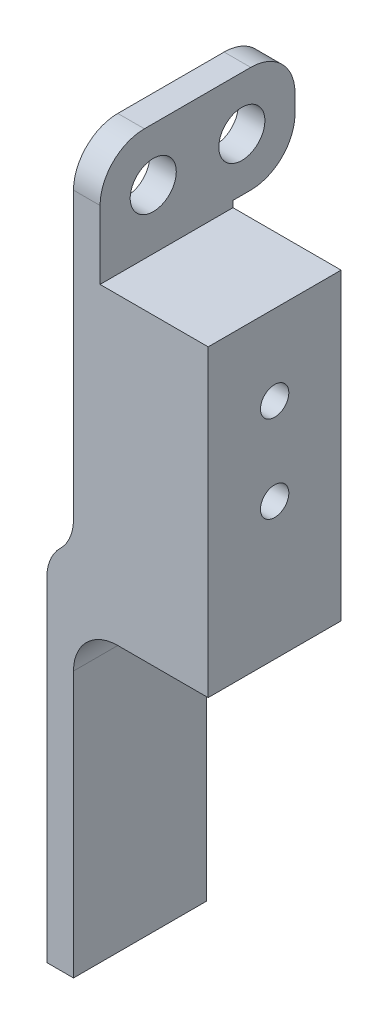
from build123d import *

# Parameters (mm, degrees)
SKETCH1_W           = 22
SKETCH1_H           = 12
SKETCH1_R           = 2.6
BOSS_EXTRUDE1_DEPTH = 3
SKETCH2_W           = 15
SKETCH2_H           = 36
BOSS_EXTRUDE2_DEPTH = 3
FILLET1_R           = 5
FILLET2_R           = 1
SKETCH4_W           = 15
SKETCH4_H           = 34.286255804
BOSS_EXTRUDE3_DEPTH = 12.2
SKETCH9_R           = 1.6
CUT_EXTRUDE1_DEPTH  = 40
SKETCH12_W          = 15
SKETCH12_H          = 40.231404522
BOSS_EXTRUDE5_DEPTH = 3
FILLET3_R           = 5
FILLET4_R           = 5
SKETCH14_W          = 15
SKETCH14_H          = 1.024404938
CUT_EXTRUDE2_DEPTH  = 3
FILLET5_R           = 5


with BuildPart() as part:
    # Sketch1 → Boss-Extrude1 (new body)
    with BuildSketch(Plane(origin=(0, 0, 0), x_dir=(0, 0, -1), z_dir=(1, 0, 0))):
        with Locations((5, 0)):
            Rectangle(SKETCH1_W, SKETCH1_H)
        with Locations((10, 0)):
            Circle(SKETCH1_R, mode=Mode.SUBTRACT)
        Circle(SKETCH1_R, mode=Mode.SUBTRACT)
    extrude(amount=BOSS_EXTRUDE1_DEPTH)

    # Sketch2 → Boss-Extrude2 (add)
    with BuildSketch(Plane(origin=(0, 0, 0), x_dir=(0, 0, -1), z_dir=(1, 0, 0))):
        with Locations((1.5, -24)):
            Rectangle(SKETCH2_W, SKETCH2_H)
    extrude(amount=BOSS_EXTRUDE2_DEPTH)

    # Fillet1
    fillet1_edges = [part.edges().sort_by_distance(p)[0] for p in [
        (1.5, -6, -16),
        (1.5, 6, 6),
        (1.5, 6, -16),
    ]]
    fillet(fillet1_edges, radius=FILLET1_R)

    # Fillet2
    fillet2_edges = [part.edges().sort_by_distance(p)[0] for p in [
        (1.5, -42, 6),
        (1.5, -42, -9),
    ]]
    fillet(fillet2_edges, radius=FILLET2_R)

    # Sketch4 → Boss-Extrude3 (add)
    with BuildSketch(Plane(origin=(3, 0, 0), x_dir=(0, 0, -1), z_dir=(1, 0, 0))):
        with Locations((1.5, -23.856872098)):
            Rectangle(SKETCH4_W, SKETCH4_H)
    extrude(amount=BOSS_EXTRUDE3_DEPTH)

    # Sketch9 → Cut-Extrude1 (cut)
    with BuildSketch(Plane.ZY):
        with Locations((-1.5, -25.546825535)):
            Circle(SKETCH9_R)
        with Locations((-1.5, -15.746825535)):
            Circle(SKETCH9_R)
    extrude(amount=-CUT_EXTRUDE1_DEPTH, mode=Mode.SUBTRACT)

    # Sketch12 → Boss-Extrude5 (add)
    with BuildSketch(Plane.ZY):
        with Locations((-1.5, -55.884297739)):
            Rectangle(SKETCH12_W, SKETCH12_H)
    extrude(amount=BOSS_EXTRUDE5_DEPTH)

    # Fillet3
    # the kernel refuses this fillet: 5 mm, written as the material it adds along each edge
    with BuildSketch(Plane(origin=(0, -35.768595478, -9), x_dir=(0, 1, 0), z_dir=(0, 0, 1))) as fillet3_piece_1:
        with BuildLine():
            CenterArc((4.582575695, 5), FILLET3_R, 203.578178478, 66.421821522)
            Line((0, 3), (-0.091651514, 2.96))
            ThreePointArc((-0.091651514, 2.96), (-0.1, 1.5), (-0.1, 0))
            Line((-0.1, 0), (0, -0.1))
            Line((0, -0.1), (4.582575695, -0.1))
            Line((4.582575695, -0.1), (4.582575695, 0))
        make_face()
    extrude(amount=15)

    # Fillet4
    fillet4_edges = [part.edges().sort_by_distance(p)[0] for p in [
        (-3, -35.768595478, -1.5),
    ]]
    fillet(fillet4_edges, radius=FILLET4_R)

    # Sketch14 → Cut-Extrude2 (cut)
    with BuildSketch(Plane(origin=(3, 0, 0), x_dir=(0, 0, -1), z_dir=(1, 0, 0))):
        with Locations((1.5, -41.512202469)):
            Rectangle(SKETCH14_W, SKETCH14_H)
    extrude(amount=-CUT_EXTRUDE2_DEPTH, mode=Mode.SUBTRACT)

    # Fillet5
    fillet5_edges = [part.edges().sort_by_distance(p)[0] for p in [
        (0, -41, -1.5),
    ]]
    fillet(fillet5_edges, radius=FILLET5_R)


solid = part.part
